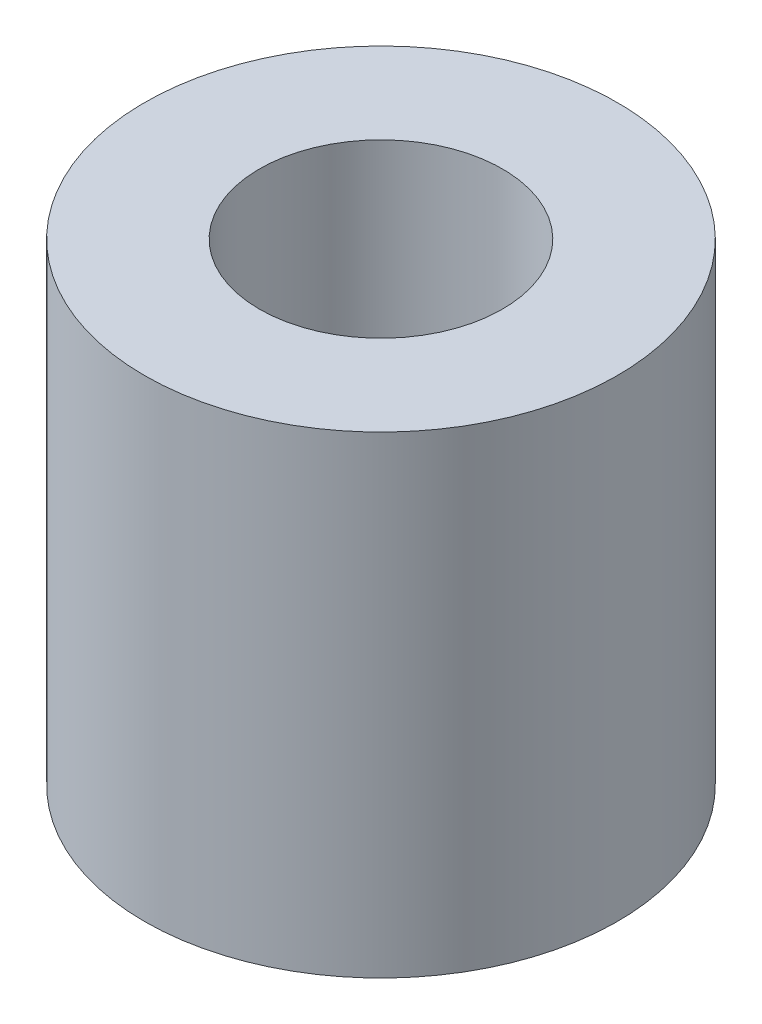
from build123d import *

# Parameters (mm, degrees)
SKETCH1_R           = 6.35
SKETCH1_R_2         = 3.2639
BOSS_EXTRUDE1_DEPTH = 12.7


with BuildPart() as part:
    # Sketch1 → Boss-Extrude1 (new body)
    with BuildSketch(Plane(origin=(0, 0, 0), x_dir=(1, 0, 0), z_dir=(0, 1, 0))):
        Circle(SKETCH1_R)
        Circle(SKETCH1_R_2, mode=Mode.SUBTRACT)
    extrude(amount=BOSS_EXTRUDE1_DEPTH)


solid = part.part
